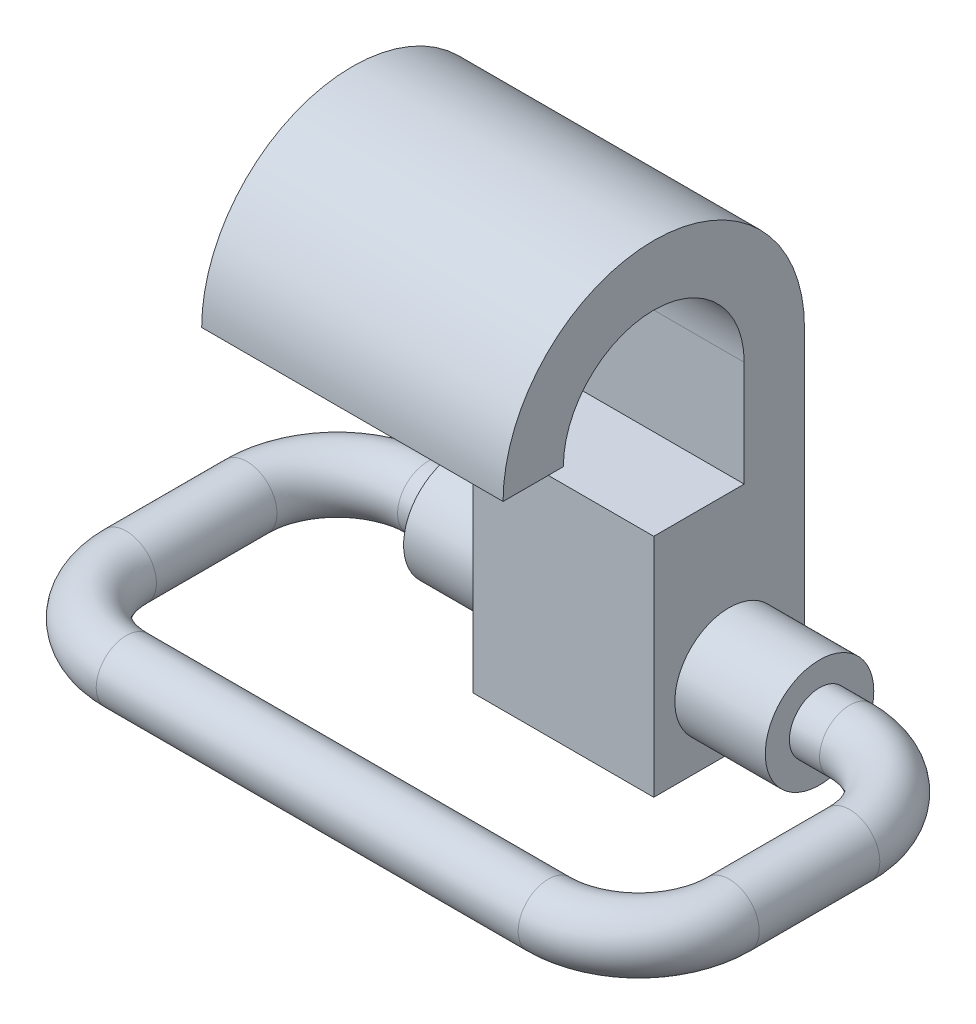
from build123d import *

# Parameters (mm, degrees)
ESBO_O1_R                 = 100
RESSALTO_EXTRUS_O2_DEPTH  = 700
ESBO_O1_9_R               = 180
ESBO_O1_9_R_2             = 100
RESSALTO_EXTRUS_O6_DEPTH  = 600
ESBO_O1_10_R              = 180
RESSALTO_EXTRUS_O7_DEPTH  = 300
ESBO_O3_W                 = 300
ESBO_O3_H                 = 200
RESSALTO_EXTRUS_O8_DEPTH  = 350
RESSALTO_EXTRUS_O9_DEPTH  = 300
ESBO_O9_R                 = 100
ESBO_O10_R                = 100
RESSALTO_EXTRUS_O10_DEPTH = 400
ESBO_O15_R                = 100
ESBO_O17_R                = 100
RESSALTO_EXTRUS_O11_DEPTH = 700
ESBO_O21_W                = 500
ESBO_O21_H                = 750
RESSALTO_EXTRUS_O12_DEPTH = 300
ESBO_O22_W                = 200
ESBO_O22_H                = 350
RESSALTO_EXTRUS_O13_DEPTH = 300
RESSALTO_EXTRUS_O14_DEPTH = 400


with BuildPart() as part:
    # Esboço1 → Ressalto-extrusão2 (new body)
    with BuildSketch(Plane(origin=(0, 0, 0), x_dir=(0, 0, -1), z_dir=(1, 0, 0))):
        with Locations((0, -135)):
            Circle(ESBO_O1_R)
    ressalto_extrus_o2 = extrude(amount=RESSALTO_EXTRUS_O2_DEPTH)

    # Esboço1<9> → Ressalto-extrusão6 (add)
    with BuildSketch(Plane(origin=(0, 0, 0), x_dir=(0, 0, -1), z_dir=(1, 0, 0))):
        with Locations((0, -135)):
            Circle(ESBO_O1_9_R)
        with Locations((0, -135)):
            Circle(ESBO_O1_9_R_2, mode=Mode.SUBTRACT)
    ressalto_extrus_o6 = extrude(amount=RESSALTO_EXTRUS_O6_DEPTH)

    # Esboço1<10> → Ressalto-extrusão7 (add)
    with BuildSketch(Plane(origin=(0, 0, 0), x_dir=(0, 0, -1), z_dir=(1, 0, 0))):
        Polygon((-250, 375), (-250, -375), (250, -375), (250, 375), (50, 375), align=None)
        with Locations((0, -135)):
            Circle(ESBO_O1_10_R, mode=Mode.SUBTRACT)
    extrude(amount=RESSALTO_EXTRUS_O7_DEPTH)

    # Esboço3 → Ressalto-extrusão8 (add)
    with BuildSketch(Plane(origin=(0, 375, 0), x_dir=(1, 0, 0), z_dir=(0, 1, 0))):
        with Locations((150, 150)):
            Rectangle(ESBO_O3_W, ESBO_O3_H)
    extrude(amount=RESSALTO_EXTRUS_O8_DEPTH)

    # Esboço5 → Ressalto-extrusão9 (add)
    with BuildSketch(Plane(origin=(300, 0, 0), x_dir=(0, 0, -1), z_dir=(1, 0, 0))):
        with BuildLine():
            Line((-750, 725), (-550, 725))
            ThreePointArc((-550, 725), (-250, 1025), (50, 725))
            Line((50, 725), (250, 725))
            ThreePointArc((250, 725), (-250, 1225), (-750, 725))
        make_face()
    ressalto_extrus_o9 = extrude(amount=-RESSALTO_EXTRUS_O9_DEPTH)

    # Varredura1: sweep along a path in Esboço8
    with BuildLine(Plane(origin=(0, -135, 0), x_dir=(-1, 0, 0), z_dir=(0, -1, 0))) as varredura1_path:
        ThreePointArc((-700, 0), (-912.132034356, -87.867965644), (-1000, -300))
    # Esboço9 → Varredura1 (sweep)
    with BuildSketch(Plane(origin=(700, 0, 0), x_dir=(0, 0, -1), z_dir=(1, 0, 0))):
        with Locations((0, -135)):
            Circle(ESBO_O9_R)
    varredura1 = sweep(path=varredura1_path.line)

    # Esboço10 → Ressalto-extrusão10 (add)
    with BuildSketch(Plane.XY.offset(300)):
        with Locations((1000, -135)):
            Circle(ESBO_O10_R)
    ressalto_extrus_o10 = extrude(amount=RESSALTO_EXTRUS_O10_DEPTH)

    # Varredura2: sweep along a path in Esboço14
    with BuildLine(Plane(origin=(0, -135, 0), x_dir=(-1, 0, 0), z_dir=(0, -1, 0))) as varredura2_path:
        ThreePointArc((-1000, -700), (-912.132034356, -912.132034356), (-700, -1000))
    # Esboço15 → Varredura2 (sweep)
    with BuildSketch(Plane.XY.offset(700)):
        with Locations((1000, -135)):
            Circle(ESBO_O15_R)
    varredura2 = sweep(path=varredura2_path.line)

    # Esboço17 → Ressalto-extrusão11 (add)
    with BuildSketch(Plane.ZY.offset(-700)):
        with Locations((1000, -135)):
            Circle(ESBO_O17_R)
    ressalto_extrus_o11 = extrude(amount=RESSALTO_EXTRUS_O11_DEPTH)

    # Espelhar1: Ressalto-extrusão11 across Right Plane
    add(ressalto_extrus_o11.mirror(Plane(origin=(0, 0, 0), x_dir=(0, 0, -1), z_dir=(1, 0, 0))))

    # Espelhar2: Varredura2 across Right Plane
    add(varredura2.mirror(Plane(origin=(0, 0, 0), x_dir=(0, 0, -1), z_dir=(1, 0, 0))))

    # Espelhar3: Ressalto-extrusão10 across Right Plane
    add(ressalto_extrus_o10.mirror(Plane(origin=(0, 0, 0), x_dir=(0, 0, -1), z_dir=(1, 0, 0))))

    # Espelhar4: Varredura1 across Right Plane
    add(varredura1.mirror(Plane(origin=(0, 0, 0), x_dir=(0, 0, -1), z_dir=(1, 0, 0))))

    # Espelhar5: Ressalto-extrusão2 across Right Plane
    add(ressalto_extrus_o2.mirror(Plane(origin=(0, 0, 0), x_dir=(0, 0, -1), z_dir=(1, 0, 0))))

    # Espelhar6: Ressalto-extrusão6 across Right Plane
    add(ressalto_extrus_o6.mirror(Plane(origin=(0, 0, 0), x_dir=(0, 0, -1), z_dir=(1, 0, 0))))

    # Espelhar7: Ressalto-extrusão9 across Right Plane
    add(ressalto_extrus_o9.mirror(Plane(origin=(0, 0, 0), x_dir=(0, 0, -1), z_dir=(1, 0, 0))))

    # Espelhar8: Ressalto-extrusão2 across plane
    add(ressalto_extrus_o2.mirror(Plane(origin=(300, 0, 0), x_dir=(0, 0, 1), z_dir=(1, 0, 0))))

    # Esboço21 → Ressalto-extrusão12 (add)
    with BuildSketch(Plane.ZY):
        Rectangle(ESBO_O21_W, ESBO_O21_H)
    extrude(amount=RESSALTO_EXTRUS_O12_DEPTH)

    # Esboço22 → Ressalto-extrusão13 (add)
    with BuildSketch(Plane.ZY):
        with Locations((-150, 550)):
            Rectangle(ESBO_O22_W, ESBO_O22_H)
    extrude(amount=RESSALTO_EXTRUS_O13_DEPTH)

    # Esboço26 → Ressalto-extrusão14 (add)
    with BuildSketch(Plane.ZY.offset(300)):
        with BuildLine():
            Line((-250, 725), (-50, 725))
            ThreePointArc((-50, 725), (250, 1025), (550, 725))
            Line((550, 725), (750, 725))
            ThreePointArc((750, 725), (250, 1225), (-250, 725))
        make_face()
    extrude(amount=RESSALTO_EXTRUS_O14_DEPTH)


solid = part.part
